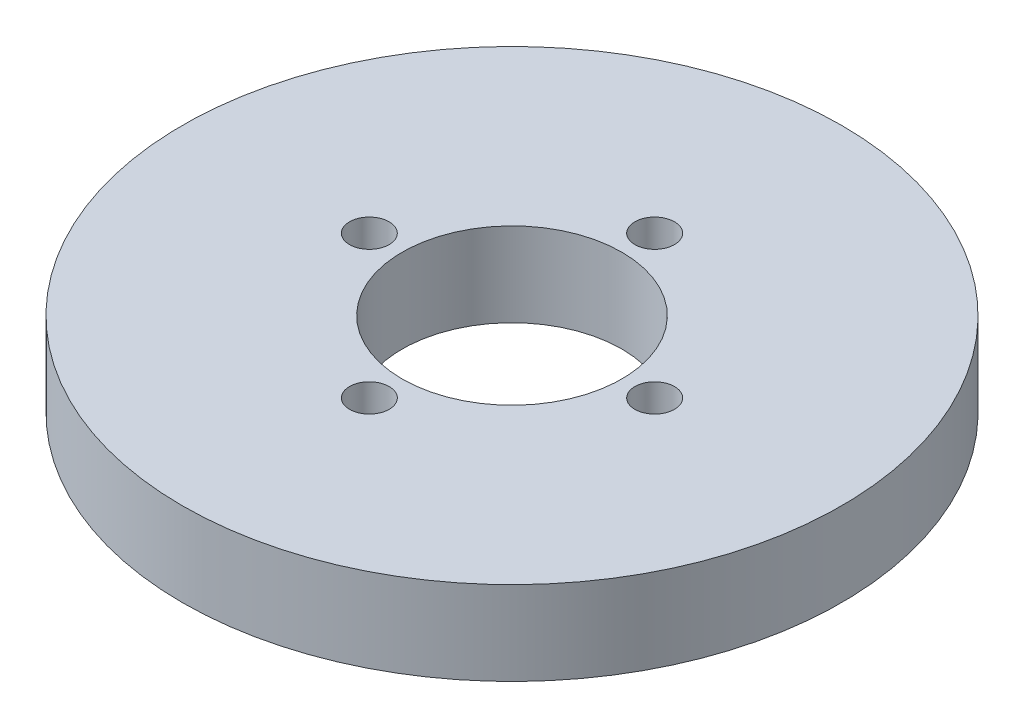
from build123d import *

# Parameters (mm, degrees)
SKETCH1_R           = 82.5
BOSS_EXTRUDE1_DEPTH = 21
SKETCH2_R           = 27.5
CUT_EXTRUDE1_DEPTH  = 119.547458851
SKETCH3_R           = 4.957911303
CUT_EXTRUDE2_DEPTH  = 14.785783363
CIRPATTERN1_COUNT   = 4


with BuildPart() as part:
    # Sketch1 → Boss-Extrude1 (new body)
    with BuildSketch(Plane(origin=(0, 0, 0), x_dir=(1, 0, 0), z_dir=(0, 1, 0))):
        Circle(SKETCH1_R)
    extrude(amount=BOSS_EXTRUDE1_DEPTH)

    # Sketch2 → Cut-Extrude1 (cut, through all)
    with BuildSketch(Plane(origin=(0, 0, 0), x_dir=(1, 0, 0), z_dir=(0, 1, 0))):
        Circle(SKETCH2_R)
    extrude(amount=CUT_EXTRUDE1_DEPTH, mode=Mode.SUBTRACT)

    # Sketch3 → Cut-Extrude2 (cut)
    with BuildSketch(Plane(origin=(0, 21, 0), x_dir=(1, 0, 0), z_dir=(0, 1, 0))):
        with Locations((-35.715084654, 0)):
            Circle(SKETCH3_R)
    cut_extrude2 = extrude(amount=-CUT_EXTRUDE2_DEPTH, mode=Mode.SUBTRACT)

    # CirPattern1: Cut-Extrude2 ×4 about axis
    cirpattern1_axis = Axis((0, 0, 0), (0, 1, 0))
    for i in range(1, CIRPATTERN1_COUNT):
        add(cut_extrude2.rotate(cirpattern1_axis, i * 360 / CIRPATTERN1_COUNT), mode=Mode.SUBTRACT)


solid = part.part
